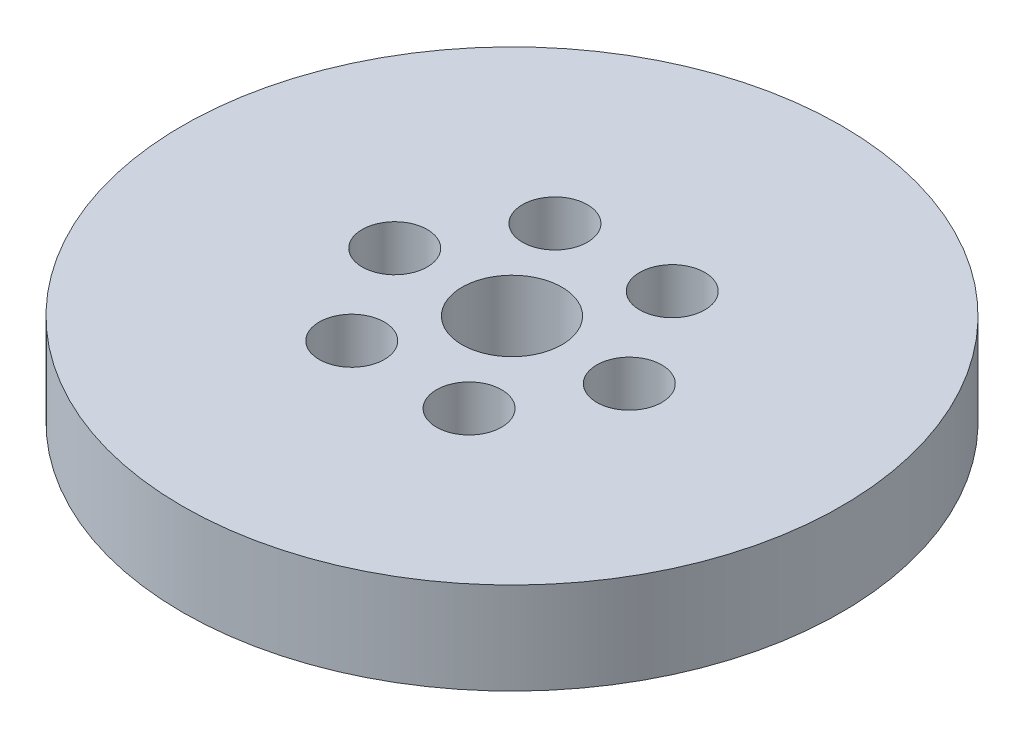
from build123d import *

# Parameters (mm, degrees)
SKETCH1_R           = 82.5
BOSS_EXTRUDE1_DEPTH = 23
SKETCH2_R           = 12.5
CUT_EXTRUDE1_DEPTH  = 119.918039002
SKETCH3_R           = 8.145470129
CUT_EXTRUDE2_DEPTH  = 20.699310232
CIRPATTERN1_COUNT   = 6


with BuildPart() as part:
    # Sketch1 → Boss-Extrude1 (new body)
    with BuildSketch(Plane(origin=(0, 0, 0), x_dir=(1, 0, 0), z_dir=(0, 1, 0))):
        Circle(SKETCH1_R)
    extrude(amount=BOSS_EXTRUDE1_DEPTH)

    # Sketch2 → Cut-Extrude1 (cut, through all)
    with BuildSketch(Plane(origin=(0, 0, 0), x_dir=(1, 0, 0), z_dir=(0, 1, 0))):
        Circle(SKETCH2_R)
    extrude(amount=CUT_EXTRUDE1_DEPTH, mode=Mode.SUBTRACT)

    # Sketch3 → Cut-Extrude2 (cut)
    with BuildSketch(Plane(origin=(0, 23, 0), x_dir=(1, 0, 0), z_dir=(0, 1, 0))):
        with Locations((-29.363445934, 0)):
            Circle(SKETCH3_R)
    cut_extrude2 = extrude(amount=-CUT_EXTRUDE2_DEPTH, mode=Mode.SUBTRACT)

    # CirPattern1: Cut-Extrude2 ×6 about axis
    cirpattern1_axis = Axis((0, 0, 0), (0, 1, 0))
    for i in range(1, CIRPATTERN1_COUNT):
        add(cut_extrude2.rotate(cirpattern1_axis, i * 360 / CIRPATTERN1_COUNT), mode=Mode.SUBTRACT)


solid = part.part
